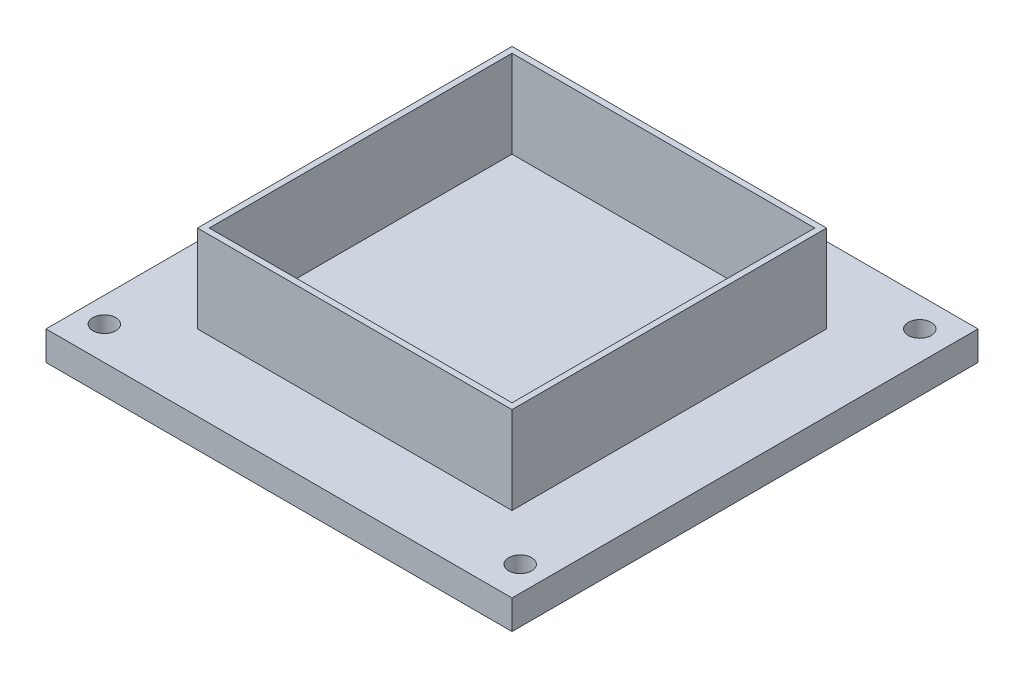
from build123d import *

# Parameters (mm, degrees)
SKETCH1_W           = 68.58
SKETCH1_H           = 68.58
SKETCH1_W_2         = 66
SKETCH1_H_2         = 66
BOSS_EXTRUDE1_DEPTH = 25.4
SKETCH2_W           = 101.6
SKETCH2_H           = 101.6
BOSS_EXTRUDE2_DEPTH = 6.35
SKETCH3_R           = 2.5
CUT_EXTRUDE1_DEPTH  = 75.324844433


with BuildPart() as part:
    # Sketch1 → Boss-Extrude1 (new body)
    with BuildSketch(Plane(origin=(0, 0, 0), x_dir=(1, 0, 0), z_dir=(0, 1, 0))):
        Rectangle(SKETCH1_W, SKETCH1_H)
        Rectangle(SKETCH1_W_2, SKETCH1_H_2, mode=Mode.SUBTRACT)
    extrude(amount=BOSS_EXTRUDE1_DEPTH)

    # Sketch2 → Boss-Extrude2 (add)
    with BuildSketch(Plane(origin=(0, 0, 0), x_dir=(1, 0, 0), z_dir=(0, 1, 0))):
        Rectangle(SKETCH2_W, SKETCH2_H)
    extrude(amount=BOSS_EXTRUDE2_DEPTH)

    # Sketch3 → Cut-Extrude1 (cut, through all)
    with BuildSketch(Plane(origin=(0, 6.35, 0), x_dir=(1, 0, 0), z_dir=(0, 1, 0))):
        with Locations((-44.45, 44.45)):
            Circle(SKETCH3_R)
        with Locations((-45.331774214, -43.550375964)):
            Circle(SKETCH3_R)
        with Locations((45.331774214, -43.550375964)):
            Circle(SKETCH3_R)
        with Locations((44.45, 44.45)):
            Circle(SKETCH3_R)
    extrude(amount=-CUT_EXTRUDE1_DEPTH, mode=Mode.SUBTRACT)


solid = part.part
